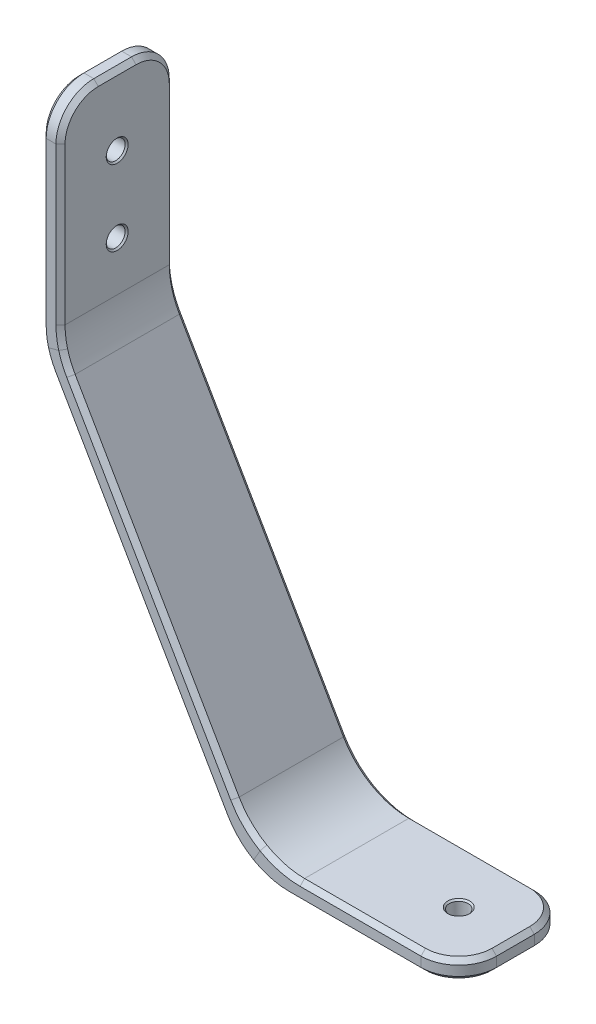
from build123d import *

# Parameters (mm, degrees)
SKETCH2_W                    = 3.175
SKETCH2_H                    = 19.05
F_1_8_0_125_DIAMETER_HOLE1_D = 3.175
F_1_8_0_125_DIAMETER_HOLE2_D = 3.175
FILLET1_R                    = 12.7
FILLET2_R                    = 6.35
CHAMFER3_SIZE                = 0.762
CHAMFER2_SIZE                = 0.254


with BuildPart() as part:
    # Sweep1: sweep along a path in Sketch1
    with BuildLine(Plane.XY) as sweep1_path:
        Line((0, 0), (0, -36.5125))
        Line((0, -36.5125), (33.61082832, -94.728162334))
        Line((33.61082832, -94.728162334), (68.53582832, -94.728162334))
    # Sketch2 → Sweep1 (sweep)
    with BuildSketch(Plane(origin=(0, 0, 0), x_dir=(1, 0, 0), z_dir=(0, 1, 0))):
        Rectangle(SKETCH2_W, SKETCH2_H)
    sweep(path=sweep1_path.line, transition=Transition.RIGHT)

    # 1/8 (0.125) Diameter Hole1 (through all)
    with Locations(Plane(origin=(1.5875, 0, 0), x_dir=(0, 0, -1), z_dir=(1, 0, 0))):
        with Locations((0, -11.693565329), (0, -24.393565329)):
            Hole(F_1_8_0_125_DIAMETER_HOLE1_D / 2)

    # 1/8 (0.125) Diameter Hole2 (through all)
    with Locations(Plane(origin=(0, -93.140662334, 0), x_dir=(1, 0, 0), z_dir=(0, 1, 0))):
        with Locations((59.01082832, 0)):
            Hole(F_1_8_0_125_DIAMETER_HOLE2_D / 2)

    # Fillet1
    fillet1_edges = [part.edges().sort_by_distance(p)[0] for p in [
        (-1.5875, -36.937869343, 0),
        (1.5875, -36.087130657, 0),
        (32.694284767, -96.315662334, 0),
        (34.527371872, -93.140662334, 0),
    ]]
    fillet(fillet1_edges, radius=FILLET1_R)

    # Fillet2
    fillet2_edges = [part.edges().sort_by_distance(p)[0] for p in [
        (68.53582832, -94.728162334, -9.525),
        (68.53582832, -94.728162334, 9.525),
        (0, 0, -9.525),
        (0, 0, 9.525),
    ]]
    fillet(fillet2_edges, radius=FILLET2_R)

    # Chamfer3
    chamfer3_edges = [part.edges().sort_by_distance(p)[0] for p in [
        (14.571043965, -64.925288467, -9.525),
        (-1.154757994, -36.821916472, -9.525),
        (33.676633186, -94.614184962, -9.525),
        (-1.154757994, -36.821916472, -9.525),
        (33.676633186, -94.614184962, -9.525),
        (-1.5875, -19.9424573, -9.525),
        (51.106230753, -96.315662334, -9.525),
        (-1.5875, -1.859871939, -7.665128061),
        (66.67595638, -96.315662334, -7.665128061),
        (-1.5875, 0, 0),
        (68.53582832, -96.315662334, 0),
        (-1.5875, -1.859871939, 7.665128061),
        (66.67595638, -96.315662334, 7.665128061),
        (-1.5875, -19.9424573, 9.525),
        (51.106230753, -96.315662334, 9.525),
        (-1.154757994, -36.821916472, 9.525),
        (33.676633186, -94.614184962, 9.525),
        (-1.154757994, -36.821916472, 9.525),
        (33.676633186, -94.614184962, 9.525),
        (14.571043965, -64.925288467, 9.525),
        (17.075087517, -62.912419124, -9.525),
        (2.020242006, -35.971177786, -9.525),
        (35.509720291, -91.439184962, -9.525),
        (2.020242006, -35.971177786, -9.525),
        (35.509720291, -91.439184962, -9.525),
        (1.5875, -19.517087957, -9.525),
        (52.022774305, -93.140662334, -9.525),
        (1.5875, -1.859871939, -7.665128061),
        (66.67595638, -93.140662334, -7.665128061),
        (1.5875, 0, 0),
        (68.53582832, -93.140662334, 0),
        (1.5875, -1.859871939, 7.665128061),
        (66.67595638, -93.140662334, 7.665128061),
        (1.5875, -19.517087957, 9.525),
        (52.022774305, -93.140662334, 9.525),
        (2.020242006, -35.971177786, 9.525),
        (35.509720291, -91.439184962, 9.525),
        (2.020242006, -35.971177786, 9.525),
        (35.509720291, -91.439184962, 9.525),
        (17.075087517, -62.912419124, 9.525),
    ]]
    chamfer(chamfer3_edges, length=CHAMFER3_SIZE)

    # Chamfer2
    chamfer2_edges = [part.edges().sort_by_distance(p)[0] for p in [
        (1.5875, -24.393565329, -1.5875),
        (-1.5875, -24.393565329, -1.5875),
        (1.5875, -11.693565329, -1.5875),
        (-1.5875, -11.693565329, -1.5875),
        (60.59832832, -93.140662334, 0),
        (60.59832832, -96.315662334, 0),
    ]]
    chamfer(chamfer2_edges, length=CHAMFER2_SIZE)


solid = part.part
